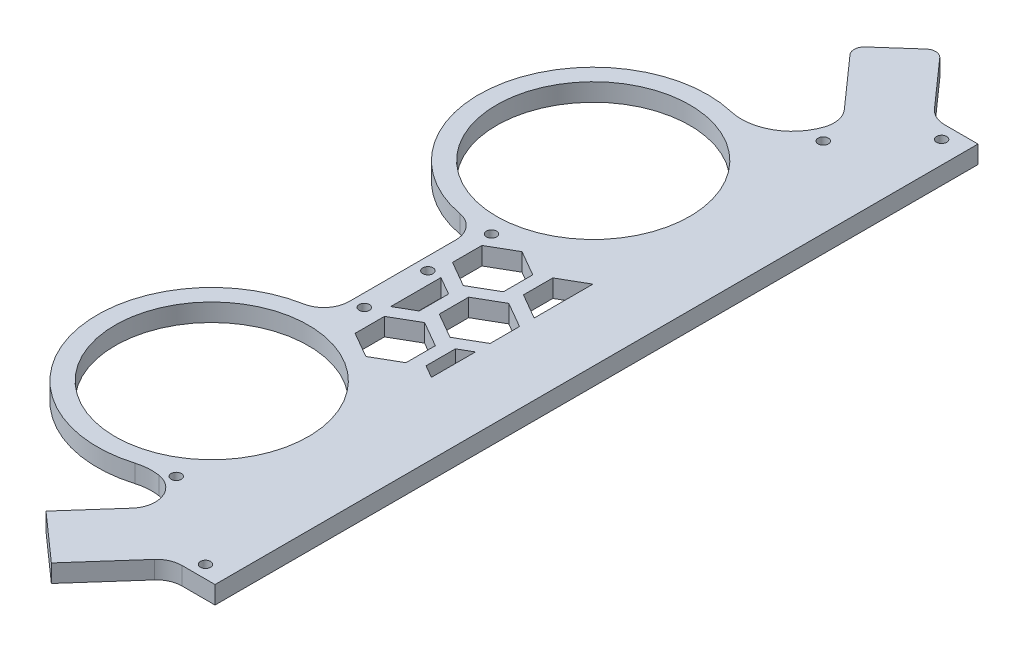
from build123d import *

# Parameters (mm, degrees)
SKETCH5_R           = 48.26
BOSS_EXTRUDE1_DEPTH = 8.89
FILLET1_R           = 25.4
SKETCH9_R           = 2.5527
CUT_EXTRUDE1_DEPTH  = 12.7
FILLET3_R           = 12.7
FILLET4_R           = 12.7
FILLET5_R           = 5.08


with BuildPart() as part:
    # Sketch5 → Boss-Extrude1 (new body)
    with BuildSketch(Plane(origin=(0, 0, 0), x_dir=(1, 0, 0), z_dir=(0, 1, 0))):
        with BuildLine():
            ThreePointArc((-215.9, -46.097790831), (-267.470384182, -127.877406649), (-171.45, -139.168815315))
            Line((-171.45, -139.168815315), (-171.45, -167.709773326))
            Line((-171.45, -167.709773326), (-200.949318136, -200.960227902))
            Line((-200.949318136, -200.960227902), (-177.198993439, -222.031169428))
            Line((-177.198993439, -222.031169428), (-149.225, -190.5))
            Line((-149.225, -190.5), (-127, -190.5))
            Line((-127, -190.5), (-127, 190.5))
            Line((-127, 190.5), (-149.225, 190.5))
            Line((-149.225, 190.5), (-177.198993439, 222.031169428))
            Line((-177.198993439, 222.031169428), (-200.949318136, 200.960227902))
            Line((-200.949318136, 200.960227902), (-171.45, 167.709773326))
            Line((-171.45, 167.709773326), (-171.45, 123.173233653))
            ThreePointArc((-171.45, 123.173233653), (-267.470384182, 111.881824988), (-215.9, 30.102209169))
            Line((-215.9, 30.102209169), (-215.9, -46.097790831))
        make_face()
        with Locations(Location((-215.9, -103.247790831, 0), (0, 0, 270))):
            Circle(SKETCH5_R, mode=Mode.SUBTRACT)
        with Locations(Location((-215.9, 87.252209169, 0), (0, 0, 270))):
            Circle(SKETCH5_R, mode=Mode.SUBTRACT)
    extrude(amount=-BOSS_EXTRUDE1_DEPTH)

    # Fillet1
    # the kernel refuses this fillet: 25.4 mm, written as the material it adds along each edge
    with BuildSketch(Plane(origin=(-171.45, 0, -123.173233653), x_dir=(0, 0, -1), z_dir=(0, -1, 0))) as fillet1_piece_1:
        with BuildLine():
            CenterArc((44.400828084, -25.4), FILLET1_R, 90, 103.342363797)
            Line((19.686411909, -31.261538462), (19.192123586, -31.378769231))
            ThreePointArc((19.192123586, -31.378769231), (12.009069237, -14.266854375), (-0.319297995, -0.395111111))
            Line((-0.319297995, -0.395111111), (0, 0.508))
            Line((0, 0.508), (44.400828084, 0.508))
            Line((44.400828084, 0.508), (44.400828084, 0))
        make_face()
    extrude(amount=8.89)
    with BuildSketch(Plane(origin=(-171.45, 0, 139.168815315), x_dir=(-0.8303696180979097, 0, 0.557212973054228), z_dir=(0, -1, 0))) as fillet1_piece_2:
        with BuildLine():
            CenterArc((41.297101209, -24.264819571), FILLET1_R, 107.194284187, 71.530497093)
            Line((15.903392067, -23.699544404), (15.395517884, -23.6882389))
            ThreePointArc((15.395517884, -23.6882389), (7.529868268, -12.132836392), (-0.421827766, -0.28306419))
            Line((-0.421827766, -0.28306419), (0.150171277, 0.485296391))
            ThreePointArc((0.150171277, 0.485296391), (16.894268676, -2.046155965), (33.638366076, 0.485296391))
            Line((33.638366076, 0.485296391), (33.788537353, 0))
        make_face()
    extrude(amount=8.89)

    # Sketch9 → Cut-Extrude1 (cut)
    with BuildSketch(Plane(origin=(0, 0, 0), x_dir=(1, 0, 0), z_dir=(0, 1, 0))):
        Polygon((-181.61, 8.105163913), (-181.61, 22.76986075), (-194.31, 30.102209169), (-207.01, 22.76986075), (-207.01, 8.105163913), (-194.31, 0.772815494), align=None)
        Polygon((-175.26, -46.887449227), (-175.26, -32.22275239), (-187.96, -24.890403971), (-200.66, -32.22275239), (-200.66, -46.887449227), (-187.96, -54.219797646), align=None)
        Polygon((-175.26, -24.890403971), (-162.56, -17.558055552), (-162.56, -2.893358715), (-175.26, 4.438989704), (-187.96, -2.893358715), (-187.96, -17.558055552), align=None)
        Polygon((-194.31, -6.559532924), (-203.345054514, -1.343141768), (-203.345054514, -26.440620918), (-194.31, -21.224229762), align=None)
        Polygon((-162.56, 33.768383379), (-162.56, 4.438989704), (-175.26, 11.771338122), (-175.26, 26.43603496), align=None)
        Polygon((-162.56, -24.890403971), (-162.56, -46.887449227), (-168.91, -43.221275018), (-168.91, -28.55657818), align=None)
        with Locations(Location((-183.436118723, -153.432579675, 0), (0, 0, 270))):
            Circle(SKETCH9_R)
        with Locations(Location((-138.1125, 183.418546383, 0), (0, 0, 270))):
            Circle(SKETCH9_R)
        with Locations(Location((-138.1125, -184.15, 0), (0, 0, 270))):
            Circle(SKETCH9_R)
        with Locations(Location((-166.939936911, 153.157179019, 0), (0, 0, 270))):
            Circle(SKETCH9_R)
        with Locations(Location((-209.55, -1.647790831, 0), (0, 0, 270))):
            Circle(SKETCH9_R)
        with Locations(Location((-209.55, -33.397790831, 0), (0, 0, 270))):
            Circle(SKETCH9_R)
        with Locations(Location((-209.55, 30.102209169, 0), (0, 0, 270))):
            Circle(SKETCH9_R)
    extrude(amount=-CUT_EXTRUDE1_DEPTH, mode=Mode.SUBTRACT)

    # Fillet3
    fillet3_edges = [part.edges().sort_by_distance(p)[0] for p in [
        (-149.225, -4.445, -190.5),
        (-171.45, -4.445, -167.709773326),
        (-171.45, -4.445, 167.709773326),
        (-149.225, -4.445, 190.5),
    ]]
    fillet(fillet3_edges, radius=FILLET3_R)

    # Fillet4
    fillet4_edges = [part.edges().sort_by_distance(p)[0] for p in [
        (-215.9, -4.445, 46.097790831),
        (-215.9, -4.445, -30.102209169),
    ]]
    fillet(fillet4_edges, radius=FILLET4_R)

    # Fillet5
    fillet5_edges = [part.edges().sort_by_distance(p)[0] for p in [
        (-200.949318136, -4.445, -200.960227902),
        (-177.198993439, -4.445, -222.031169428),
    ]]
    fillet(fillet5_edges, radius=FILLET5_R)


solid = part.part
